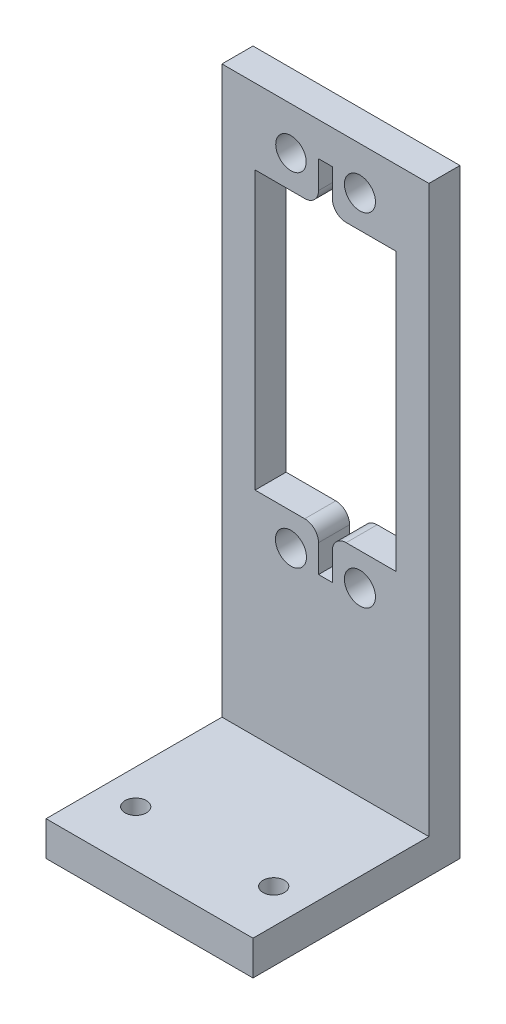
from build123d import *

# Parameters (mm, degrees)
SKETCH_1_W          = 30
SKETCH_1_H          = 62
SKETCH_1_W_2        = 20.4
SKETCH_1_H_2        = 40.2
EXTRUDE_1_DEPTH     = 4.5
SKETCH_3_R          = 2.25
SKETCH_3_R_2        = 2.20649786
CUT_EXTRUDE_1_DEPTH = 35.731109974
SKETCH_5_W          = 30
SKETCH_5_H          = 4.5
EXTRUDE_3_DEPTH     = 20
SKETCH_6_W          = 30
SKETCH_6_H          = 30
EXTRUDE_4_DEPTH     = 5
SKETCH_7_R          = 1.55
CUT_EXTRUDE_2_DEPTH = 94.241621608
SKETCH_8_W          = 2
SKETCH_8_H          = 6
CUT_EXTRUDE_3_DEPTH = 64.334429815
FILLET_1_R          = 2


with BuildPart() as part:
    # 草图1 → 凸台-拉伸1 (new body)
    with BuildSketch(Plane.XY):
        Rectangle(SKETCH_1_W, SKETCH_1_H)
        Rectangle(SKETCH_1_W_2, SKETCH_1_H_2, mode=Mode.SUBTRACT)
    extrude(amount=EXTRUDE_1_DEPTH)

    # 草图3 → 切除-拉伸1 (cut, through all)
    with BuildSketch(Plane(origin=(0, 0, 0), x_dir=(-1, 0, 0), z_dir=(0, 0, -1))):
        with Locations((-5, -24.8)):
            Circle(SKETCH_3_R)
        with Locations((5, -24.8)):
            Circle(SKETCH_3_R)
        with Locations((-5, 24.8)):
            Circle(SKETCH_3_R)
        with Locations((5, 24.8)):
            Circle(SKETCH_3_R_2)
    extrude(amount=-CUT_EXTRUDE_1_DEPTH, mode=Mode.SUBTRACT)

    # 草图5 → 凸台-拉伸3 (add)
    with BuildSketch(Plane.XZ.offset(31)):
        with Locations((0, 2.25)):
            Rectangle(SKETCH_5_W, SKETCH_5_H)
    extrude(amount=EXTRUDE_3_DEPTH)

    # 草图6 → 凸台-拉伸4 (add)
    with BuildSketch(Plane.XZ.offset(51)):
        with Locations((0, 15)):
            Rectangle(SKETCH_6_W, SKETCH_6_H)
    extrude(amount=EXTRUDE_4_DEPTH)

    # 草图7 → 切除-拉伸2 (cut, through all)
    with BuildSketch(Plane.XZ.offset(56)):
        with Locations((10, 22)):
            Circle(SKETCH_7_R)
        with Locations((-10, 22)):
            Circle(SKETCH_7_R)
    extrude(amount=-CUT_EXTRUDE_2_DEPTH, mode=Mode.SUBTRACT)

    # 草图8 → 切除-拉伸3 (cut, through all)
    with BuildSketch(Plane.XY.offset(4.5)):
        with Locations((0, -23.1)):
            Rectangle(SKETCH_8_W, SKETCH_8_H)
        with Locations((0, 23.1)):
            Rectangle(SKETCH_8_W, SKETCH_8_H)
    extrude(amount=-CUT_EXTRUDE_3_DEPTH, mode=Mode.SUBTRACT)

    # 圆角1
    fillet_1_edges = [part.edges().sort_by_distance(p)[0] for p in [
        (1, 20.1, 2.25),
        (-1, 20.1, 2.25),
        (1, -20.1, 2.25),
        (-1, -20.1, 2.25),
    ]]
    fillet(fillet_1_edges, radius=FILLET_1_R)


solid = part.part
